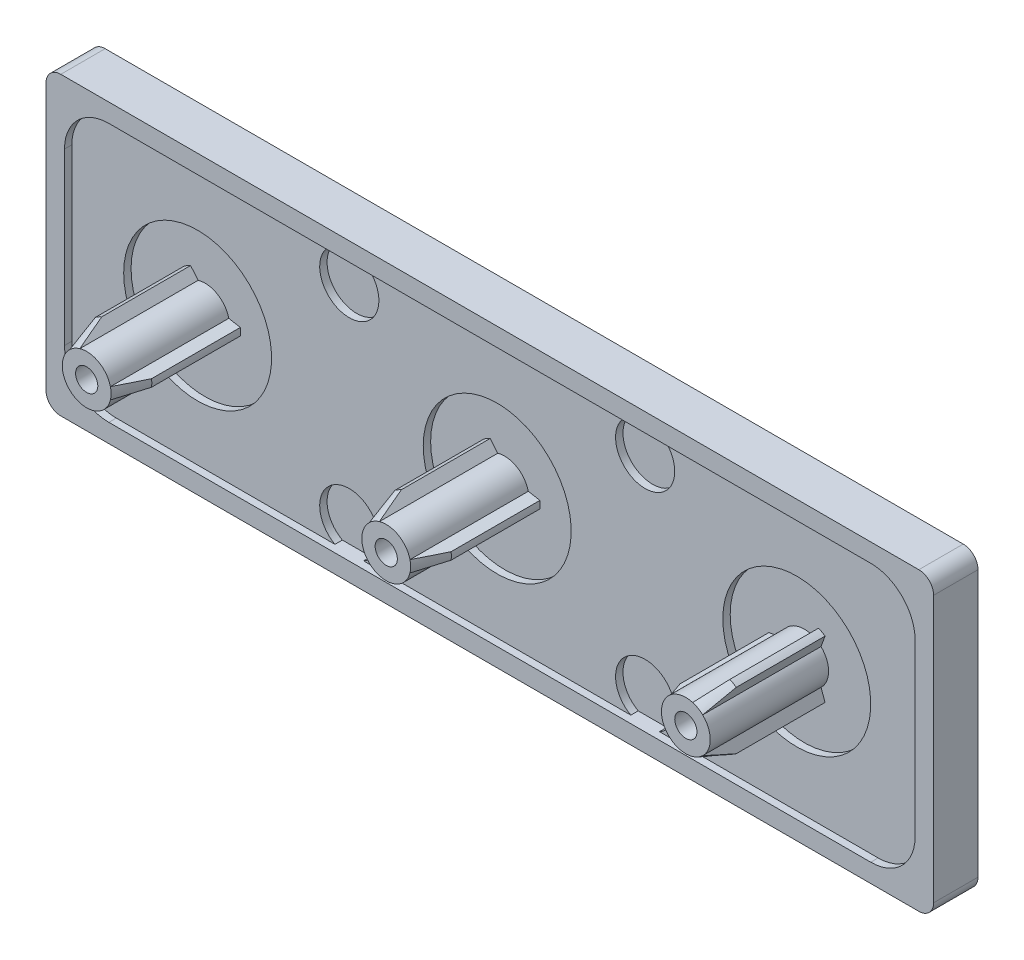
from build123d import *

# Parameters (mm, degrees)
BOSS_EXTRUDE1_DEPTH = 3
CUT_EXTRUDE1_DEPTH  = 0.5
SKETCH3_W           = 5
SKETCH3_H           = 0.5
SKETCH4_W           = 5
SKETCH4_H           = 0.5
SKETCH5_W           = 5
SKETCH5_H           = 0.5
CUT_EXTRUDE2_DEPTH  = 0.5
CUT_EXTRUDE3_DEPTH  = 0.5
CUT_EXTRUDE4_DEPTH  = 0.5
CUT_EXTRUDE5_DEPTH  = 0.5
BOSS_EXTRUDE2_DEPTH = 8
BOSS_EXTRUDE3_DEPTH = 8
BOSS_EXTRUDE4_DEPTH = 8
SKETCH16_W          = 0.75
SKETCH16_H          = 8
SKETCH17_W          = 0.75
SKETCH17_H          = 8
SKETCH18_W          = 0.75
SKETCH18_H          = 8


with BuildPart() as part:
    # Sketch1 → Boss-Extrude1 (new body)
    with BuildSketch(Plane.XY):
        with BuildLine():
            Line((-29, -10), (29, -10))
            ThreePointArc((29, -10), (29.707106781, -9.707106781), (30, -9))
            Line((30, -9), (30, 9))
            ThreePointArc((30, 9), (29.707106781, 9.707106781), (29, 10))
            Line((29, 10), (-29, 10))
            ThreePointArc((-29, 10), (-29.707106781, 9.707106781), (-30, 9))
            Line((-30, 9), (-30, -9))
            ThreePointArc((-30, -9), (-29.707106781, -9.707106781), (-29, -10))
        make_face()
    extrude(amount=-BOSS_EXTRUDE1_DEPTH)

    # Sketch2 → Cut-Extrude1 (cut)
    with BuildSketch(Plane.XY):
        with BuildLine():
            Line((-25.75, -8.75), (25.75, -8.75))
            ThreePointArc((25.75, -8.75), (27.871320344, -7.871320344), (28.75, -5.75))
            Line((28.75, -5.75), (28.75, 5.75))
            ThreePointArc((28.75, 5.75), (27.871320344, 7.871320344), (25.75, 8.75))
            Line((25.75, 8.75), (-25.75, 8.75))
            ThreePointArc((-25.75, 8.75), (-27.871320344, 7.871320344), (-28.75, 5.75))
            Line((-28.75, 5.75), (-28.75, -5.75))
            ThreePointArc((-28.75, -5.75), (-27.871320344, -7.871320344), (-25.75, -8.75))
        make_face()
    extrude(amount=-CUT_EXTRUDE1_DEPTH, mode=Mode.SUBTRACT)

    # Sketch3 → Cut-Revolve1 (revolve, cut)
    with BuildSketch(Plane(origin=(0, 0, 0), x_dir=(1, 0, 0), z_dir=(0, 1, 0))):
        with Locations((-17.75, 0.75)):
            Rectangle(SKETCH3_W, SKETCH3_H)
    revolve(axis=Axis((-20.25, 0, -0.5), (0, 0, -1)), mode=Mode.SUBTRACT)

    # Sketch4 → Cut-Revolve2 (revolve, cut)
    with BuildSketch(Plane(origin=(0, 0, 0), x_dir=(1, 0, 0), z_dir=(0, 1, 0))):
        with Locations((2.5, 0.75)):
            Rectangle(SKETCH4_W, SKETCH4_H)
    revolve(axis=Axis((0, 0, -0.5), (0, 0, -1)), mode=Mode.SUBTRACT)

    # Sketch5 → Cut-Revolve3 (revolve, cut)
    with BuildSketch(Plane(origin=(0, 0, 0), x_dir=(1, 0, 0), z_dir=(0, 1, 0))):
        with Locations((22.75, 0.75)):
            Rectangle(SKETCH5_W, SKETCH5_H)
    revolve(axis=Axis((20.25, 0, -0.5), (0, 0, -1)), mode=Mode.SUBTRACT)

    # Sketch6 → Cut-Extrude2 (cut)
    with BuildSketch(Plane.XY.offset(-0.5)):
        with BuildLine():
            Line((-9.031754163, 8.75), (-10.968245837, 8.75))
            ThreePointArc((-10.968245837, 8.75), (-10, 5), (-9.031754163, 8.75))
        make_face()
    extrude(amount=-CUT_EXTRUDE2_DEPTH, mode=Mode.SUBTRACT)

    # Sketch7 → Cut-Extrude3 (cut)
    with BuildSketch(Plane.XY.offset(-0.5)):
        with BuildLine():
            Line((10.968245837, 8.75), (9.031754163, 8.75))
            ThreePointArc((9.031754163, 8.75), (10, 5), (10.968245837, 8.75))
        make_face()
    extrude(amount=-CUT_EXTRUDE3_DEPTH, mode=Mode.SUBTRACT)

    # Sketch8 → Cut-Extrude4 (cut)
    with BuildSketch(Plane.XY.offset(-0.5)):
        with BuildLine():
            Line((-10.968245837, -8.75), (-9.031754163, -8.75))
            ThreePointArc((-9.031754163, -8.75), (-10, -5), (-10.968245837, -8.75))
        make_face()
    extrude(amount=-CUT_EXTRUDE4_DEPTH, mode=Mode.SUBTRACT)

    # Sketch9 → Cut-Extrude5 (cut)
    with BuildSketch(Plane.XY.offset(-0.5)):
        with BuildLine():
            Line((9.031754163, -8.75), (10.968245837, -8.75))
            ThreePointArc((10.968245837, -8.75), (10, -5), (9.031754163, -8.75))
        make_face()
    extrude(amount=-CUT_EXTRUDE5_DEPTH, mode=Mode.SUBTRACT)

    # Sketch10 → Boss-Extrude2 (add)
    with BuildSketch(Plane.XY.offset(-1)):
        with BuildLine():
            Line((-1.13937326, -1.193452376), (-1.409978177, -1.94215384))
            ThreePointArc((-1.409978177, -1.94215384), (-1.2, -2.078460969), (-0.976965475, -2.19215384))
            Line((-0.976965475, -2.19215384), (-0.463873445, -1.583452376))
            ThreePointArc((-0.463873445, -1.583452376), (0.825, -1.428941916), (1.603246706, -0.39))
            Line((1.603246706, -0.39), (2.386943652, -0.25))
            ThreePointArc((2.386943652, -0.25), (2.4, 0), (2.386943652, 0.25))
            Line((2.386943652, 0.25), (1.603246706, 0.39))
            ThreePointArc((1.603246706, 0.39), (0.825, 1.428941916), (-0.463873445, 1.583452376))
            Line((-0.463873445, 1.583452376), (-0.976965475, 2.19215384))
            ThreePointArc((-0.976965475, 2.19215384), (-1.2, 2.078460969), (-1.409978177, 1.94215384))
            Line((-1.409978177, 1.94215384), (-1.13937326, 1.193452376))
            ThreePointArc((-1.13937326, 1.193452376), (-1.65, 0), (-1.13937326, -1.193452376))
        make_face()
    extrude(amount=BOSS_EXTRUDE2_DEPTH)

    # Sketch11 → Boss-Extrude3 (add)
    with BuildSketch(Plane.XY.offset(-1)):
        with BuildLine():
            Line((-21.38937326, -1.193452376), (-21.659978177, -1.94215384))
            ThreePointArc((-21.659978177, -1.94215384), (-21.45, -2.078460969), (-21.226965475, -2.19215384))
            Line((-21.226965475, -2.19215384), (-20.713873445, -1.583452376))
            ThreePointArc((-20.713873445, -1.583452376), (-19.425, -1.428941916), (-18.646753294, -0.39))
            Line((-18.646753294, -0.39), (-17.863056348, -0.25))
            ThreePointArc((-17.863056348, -0.25), (-17.85, 0), (-17.863056348, 0.25))
            Line((-17.863056348, 0.25), (-18.646753294, 0.39))
            ThreePointArc((-18.646753294, 0.39), (-19.425, 1.428941916), (-20.713873445, 1.583452376))
            Line((-20.713873445, 1.583452376), (-21.226965475, 2.19215384))
            ThreePointArc((-21.226965475, 2.19215384), (-21.45, 2.078460969), (-21.659978177, 1.94215384))
            Line((-21.659978177, 1.94215384), (-21.38937326, 1.193452376))
            ThreePointArc((-21.38937326, 1.193452376), (-21.9, 0), (-21.38937326, -1.193452376))
        make_face()
    extrude(amount=BOSS_EXTRUDE3_DEPTH)

    # Sketch12 → Boss-Extrude4 (add)
    with BuildSketch(Plane.XY.offset(-1)):
        with BuildLine():
            Line((17.863056348, -0.25), (18.646753294, -0.39))
            ThreePointArc((18.646753294, -0.39), (19.425, -1.428941916), (20.713873445, -1.583452376))
            Line((20.713873445, -1.583452376), (21.226965475, -2.19215384))
            ThreePointArc((21.226965475, -2.19215384), (21.45, -2.078460969), (21.659978177, -1.94215384))
            Line((21.659978177, -1.94215384), (21.38937326, -1.193452376))
            ThreePointArc((21.38937326, -1.193452376), (21.9, 0), (21.38937326, 1.193452376))
            Line((21.38937326, 1.193452376), (21.659978177, 1.94215384))
            ThreePointArc((21.659978177, 1.94215384), (21.45, 2.078460969), (21.226965475, 2.19215384))
            Line((21.226965475, 2.19215384), (20.713873445, 1.583452376))
            ThreePointArc((20.713873445, 1.583452376), (19.425, 1.428941916), (18.646753294, 0.39))
            Line((18.646753294, 0.39), (17.863056348, 0.25))
            ThreePointArc((17.863056348, 0.25), (17.85, 0), (17.863056348, -0.25))
        make_face()
    extrude(amount=BOSS_EXTRUDE4_DEPTH)

    # Sketch13 → Cut-Revolve4 (revolve, cut)
    with BuildSketch(Plane(origin=(0, 0, 0), x_dir=(1, 0, 0), z_dir=(0, 1, 0))):
        Polygon((-18.7125, -7.3), (-17.55, -7.3), (-17.55, -4.2), align=None)
    revolve(axis=Axis((-20.25, 0, 50), (0, 0, -1)), mode=Mode.SUBTRACT)

    # Sketch14 → Cut-Revolve5 (revolve, cut)
    with BuildSketch(Plane(origin=(0, 0, 0), x_dir=(1, 0, 0), z_dir=(0, 1, 0))):
        Polygon((1.5375, -7.3), (2.7, -7.3), (2.7, -4.2), align=None)
    revolve(axis=Axis((0, 0, 50), (0, 0, -1)), mode=Mode.SUBTRACT)

    # Sketch15 → Cut-Revolve6 (revolve, cut)
    with BuildSketch(Plane(origin=(0, 0, 0), x_dir=(1, 0, 0), z_dir=(0, 1, 0))):
        Polygon((21.7875, -7.3), (22.95, -7.3), (22.95, -4.2), align=None)
    revolve(axis=Axis((20.25, 0, 50), (0, 0, -1)), mode=Mode.SUBTRACT)

    # Sketch16 → Cut-Revolve7 (revolve, cut)
    with BuildSketch(Plane(origin=(0, 0, 0), x_dir=(1, 0, 0), z_dir=(0, 1, 0))):
        with Locations((-19.875, -3)):
            Rectangle(SKETCH16_W, SKETCH16_H)
    revolve(axis=Axis((-20.25, 0, 7), (0, 0, -1)), mode=Mode.SUBTRACT)

    # Sketch17 → Cut-Revolve8 (revolve, cut)
    with BuildSketch(Plane(origin=(0, 0, 0), x_dir=(1, 0, 0), z_dir=(0, 1, 0))):
        with Locations((0.375, -3)):
            Rectangle(SKETCH17_W, SKETCH17_H)
    revolve(axis=Axis((0, 0, 7), (0, 0, -1)), mode=Mode.SUBTRACT)

    # Sketch18 → Cut-Revolve9 (revolve, cut)
    with BuildSketch(Plane(origin=(0, 0, 0), x_dir=(1, 0, 0), z_dir=(0, 1, 0))):
        with Locations((20.625, -3)):
            Rectangle(SKETCH18_W, SKETCH18_H)
    revolve(axis=Axis((20.25, 0, 7), (0, 0, -1)), mode=Mode.SUBTRACT)


solid = part.part
